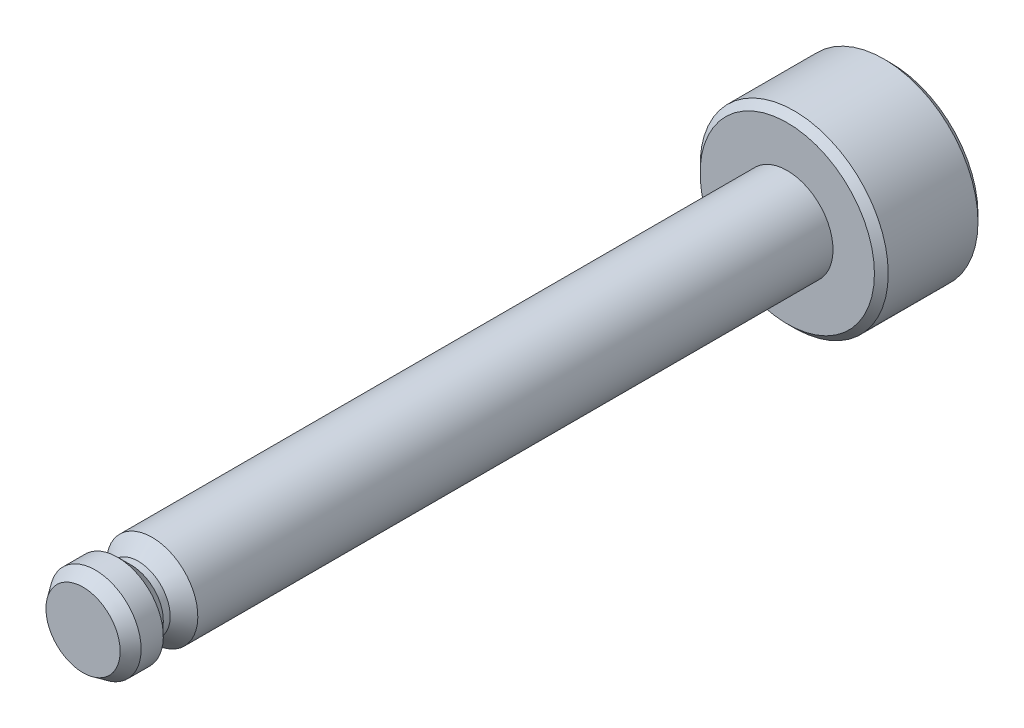
from build123d import *

# Parameters (mm, degrees)
SKETCH2_R      = 1.325
SHAFT_DEPTH    = 20.4
SKETCH5_R      = 2.725
HEAD_DEPTH     = 3
CHAMFER1_SIZE  = 0.25
CHAMFER1_SIZE2 = 0.357037002
DEBURS_SIZE    = 0.2


with BuildPart() as part:
    # Sketch2 → Shaft (new body)
    with BuildSketch(Plane.XY):
        Circle(SKETCH2_R)
    extrude(amount=SHAFT_DEPTH)

    # Sketch5 → Head (add)
    with BuildSketch(Plane.XY):
        Circle(SKETCH5_R)
    extrude(amount=-HEAD_DEPTH)

    # Chamfer1
    chamfer1_edges = [part.edges().sort_by_distance(p)[0] for p in [
        (-1.325, 0, 20.4),
    ]]
    chamfer1_side = [part.faces().sort_by_distance(p)[0] for p in [
        (0, 0, 20.4),
    ]]
    chamfer(chamfer1_edges, length=CHAMFER1_SIZE, length2=CHAMFER1_SIZE2, reference=chamfer1_side[0])

    # Deburs
    deburs_edges = [part.edges().sort_by_distance(p)[0] for p in [
        (-2.725, 0, 0),
        (-2.725, 0, -3),
    ]]
    chamfer(deburs_edges, length=DEBURS_SIZE)

    # Sketch6 → e-Clip Notch Long (revolve, cut)
    with BuildSketch(Plane(origin=(0, 0, 0), x_dir=(0, 0, -1), z_dir=(1, 0, 0))):
        Polygon((-19.4, 1.325), (-18.4, 1.325), (-18.8, 0.925), (-19, 0.925), align=None)
    revolve(axis=Axis((0, 0, 0), (0, 0, 1)), mode=Mode.SUBTRACT)


solid = part.part
